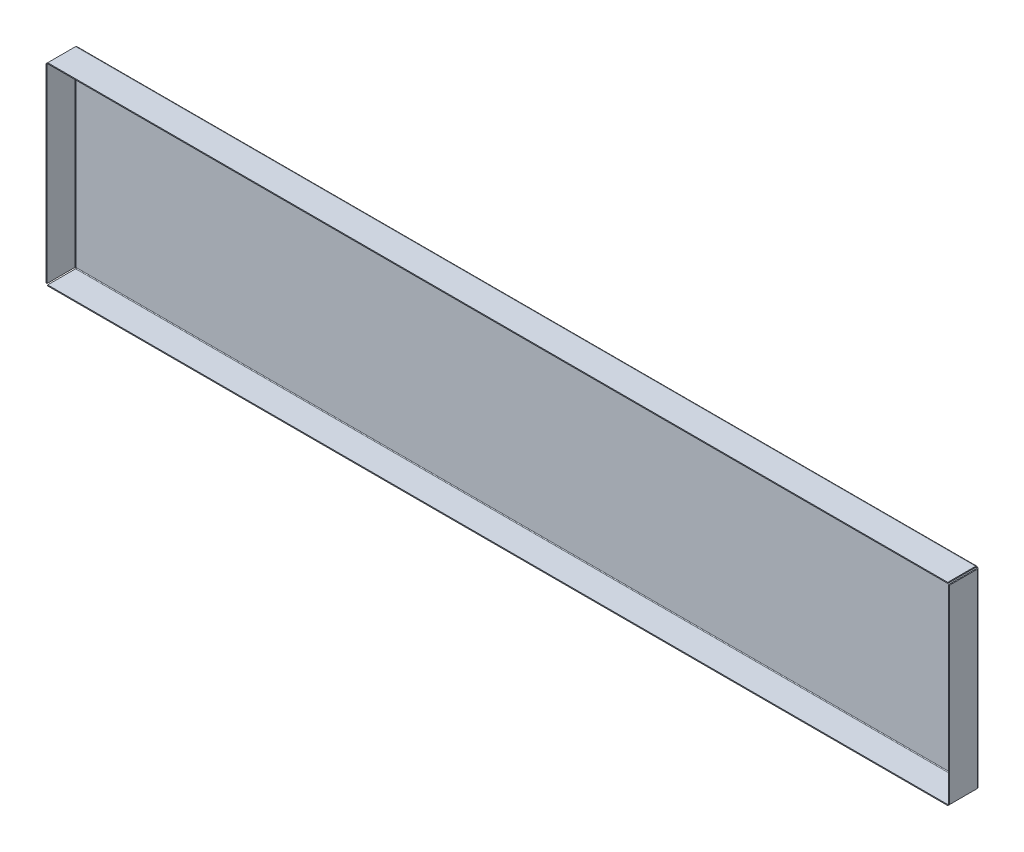
from build123d import *

# Parameters (mm, degrees)
BASE_FLANGE1_DEPTH         = 1
SKETCHED_START             = 31
SKETCHED_BEND1_DEPTH       = 198
SKETCHED_BEND1_2_DEPTH     = 938
SKETCHED_BEND1_3_OUTLINE_W = 938
SKETCHED_BEND1_3_OUTLINE_H = 1
SKETCHED_BEND1_3_DEPTH     = 29.234623369
SKETCHED_START_2           = 230.765376631
SKETCHED_BEND1_4_OUTLINE_W = 938
SKETCHED_BEND1_4_OUTLINE_H = 1
SKETCHED_BEND1_4_DEPTH     = 29.234623369
SKETCHED_BEND1_5_DEPTH     = 198
SKETCHED_BEND1_6_DEPTH     = 938
SKETCHED_BEND1_7_OUTLINE_W = 198
SKETCHED_BEND1_7_OUTLINE_H = 1
SKETCHED_BEND1_7_DEPTH     = 29.234623369
SKETCHED_START_3           = 970.765376631
SKETCHED_BEND1_8_OUTLINE_W = 198
SKETCHED_BEND1_8_OUTLINE_H = 1
SKETCHED_BEND1_8_DEPTH     = 29.234623369


# Read off the part's stored shape, not the designer's step: Sketched Bend1
# Sheet-metal steps are written as plain solids
with BuildPart() as part:
    # Sketch1 → Base-Flange1 (new body)
    with BuildSketch(Plane.XY):
        Polygon((0, 229), (31, 229), (31, 260), (969, 260), (969, 229), (1000, 229), (1000, 31), (969, 31), (969, 0), (31, 0), (31, 31), (0, 31), align=None)
    extrude(amount=-BASE_FLANGE1_DEPTH)

    # Sketched Bend1 outline → Sketched Bend1 (add)
    with BuildSketch(Plane(origin=(0, 0, 0), x_dir=(1, 0, 0), z_dir=(0, 1, 0)).offset(SKETCHED_START)):
        with BuildLine():
            Line((29.234623369, -0.7366), (29.234623369, -29.765376631))
            Line((29.234623369, -29.765376631), (30.234623369, -29.765376631))
            Line((30.234623369, -29.765376631), (30.234623369, -0.7366))
            ThreePointArc((30.234623369, -0.7366), (30.450368514, -0.215745145), (30.971223369, 0))
            Line((30.971223369, 0), (29.398582279, 0))
            ThreePointArc((29.398582279, 0), (29.276108612, -0.359286442), (29.234623369, -0.7366))
        make_face()
        with BuildLine():
            Line((970.601417721, 0), (969.028776631, 0))
            ThreePointArc((969.028776631, 0), (969.549631486, -0.215745145), (969.765376631, -0.7366))
            Line((969.765376631, -0.7366), (969.765376631, -29.765376631))
            Line((969.765376631, -29.765376631), (970.765376631, -29.765376631))
            Line((970.765376631, -29.765376631), (970.765376631, -0.7366))
            ThreePointArc((970.765376631, -0.7366), (970.723891388, -0.359286442), (970.601417721, 0))
        make_face()
    extrude(amount=SKETCHED_BEND1_DEPTH)

    # Sketched Bend1 2 outline → Sketched Bend1 2 (add)
    with BuildSketch(Plane.YZ.offset(SKETCHED_START)):
        with BuildLine():
            Line((229.028776631, 0), (230.601417721, 0))
            ThreePointArc((230.601417721, 0), (230.723891388, 0.359286442), (230.765376631, 0.7366))
            Line((230.765376631, 0.7366), (230.765376631, 29.765376631))
            Line((230.765376631, 29.765376631), (229.765376631, 29.765376631))
            Line((229.765376631, 29.765376631), (229.765376631, 0.7366))
            ThreePointArc((229.765376631, 0.7366), (229.549631486, 0.215745145), (229.028776631, 0))
        make_face()
        with BuildLine():
            ThreePointArc((29.234623369, 0.7366), (29.276108612, 0.359286442), (29.398582279, 0))
            Line((29.398582279, 0), (30.971223369, 0))
            ThreePointArc((30.971223369, 0), (30.450368514, 0.215745145), (30.234623369, 0.7366))
            Line((30.234623369, 0.7366), (30.234623369, 29.765376631))
            Line((30.234623369, 29.765376631), (29.234623369, 29.765376631))
            Line((29.234623369, 29.765376631), (29.234623369, 0.7366))
        make_face()
    extrude(amount=SKETCHED_BEND1_2_DEPTH)

    # Sketched Bend1 3 outline → Sketched Bend1 3 (cut)
    with BuildSketch(Plane(origin=(0, 0, 0), x_dir=(1, 0, 0), z_dir=(0, 1, 0))):
        with Locations((500, 0.5)):
            Rectangle(SKETCHED_BEND1_3_OUTLINE_W, SKETCHED_BEND1_3_OUTLINE_H)
    extrude(amount=SKETCHED_BEND1_3_DEPTH, mode=Mode.SUBTRACT)

    # Sketched Bend1 4 outline → Sketched Bend1 4 (cut)
    with BuildSketch(Plane(origin=(0, 0, 0), x_dir=(1, 0, 0), z_dir=(0, 1, 0)).offset(SKETCHED_START_2)):
        with Locations((500, 0.5)):
            Rectangle(SKETCHED_BEND1_4_OUTLINE_W, SKETCHED_BEND1_4_OUTLINE_H)
    extrude(amount=SKETCHED_BEND1_4_DEPTH, mode=Mode.SUBTRACT)

    # Sketched Bend1 5 outline → Sketched Bend1 5 (cut)
    with BuildSketch(Plane(origin=(0, 0, 0), x_dir=(1, 0, 0), z_dir=(0, 1, 0)).offset(SKETCHED_START)):
        with BuildLine():
            Line((0, 0), (29.398582279, 0))
            ThreePointArc((29.398582279, 0), (30.039397205, 0.728828115), (30.971223369, 1))
            Line((30.971223369, 1), (0, 1))
            Line((0, 1), (0, 0))
        make_face()
        with BuildLine():
            Line((1000, 1), (969.028776631, 1))
            ThreePointArc((969.028776631, 1), (969.960602795, 0.728828115), (970.601417721, 0))
            Line((970.601417721, 0), (1000, 0))
            Line((1000, 0), (1000, 1))
        make_face()
    extrude(amount=SKETCHED_BEND1_5_DEPTH, mode=Mode.SUBTRACT)

    # Sketched Bend1 6 outline → Sketched Bend1 6 (cut)
    with BuildSketch(Plane.YZ.offset(SKETCHED_START)):
        with BuildLine():
            ThreePointArc((230.601417721, 0), (229.960602795, -0.728828115), (229.028776631, -1))
            Line((229.028776631, -1), (260, -1))
            Line((260, -1), (260, 0))
            Line((260, 0), (230.601417721, 0))
        make_face()
        with BuildLine():
            Line((0, -1), (30.971223369, -1))
            ThreePointArc((30.971223369, -1), (30.039397205, -0.728828115), (29.398582279, 0))
            Line((29.398582279, 0), (0, 0))
            Line((0, 0), (0, -1))
        make_face()
    extrude(amount=SKETCHED_BEND1_6_DEPTH, mode=Mode.SUBTRACT)

    # Sketched Bend1 7 outline → Sketched Bend1 7 (cut)
    with BuildSketch(Plane.YZ):
        with Locations((130, -0.5)):
            Rectangle(SKETCHED_BEND1_7_OUTLINE_W, SKETCHED_BEND1_7_OUTLINE_H)
    extrude(amount=SKETCHED_BEND1_7_DEPTH, mode=Mode.SUBTRACT)

    # Sketched Bend1 8 outline → Sketched Bend1 8 (cut)
    with BuildSketch(Plane.YZ.offset(SKETCHED_START_3)):
        with Locations((130, -0.5)):
            Rectangle(SKETCHED_BEND1_8_OUTLINE_W, SKETCHED_BEND1_8_OUTLINE_H)
    extrude(amount=SKETCHED_BEND1_8_DEPTH, mode=Mode.SUBTRACT)


solid = part.part
